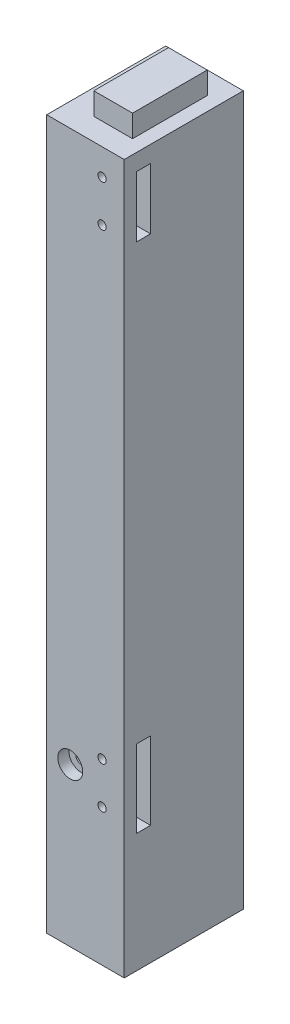
from build123d import *

# Parameters (mm, degrees)
SKETCH1_W           = 88.9
SKETCH1_H           = 812.8
BOSS_EXTRUDE1_DEPTH = 136.525
SKETCH2_W           = 44.45
SKETCH2_H           = 85.725
BOSS_EXTRUDE2_DEPTH = 25.4
SKETCH4_W           = 15.875
SKETCH4_H           = 88.9
SKETCH4_H_2         = 69.85
CUT_EXTRUDE1_DEPTH  = 50.8
SKETCH5_W           = 25.4
SKETCH5_H           = 82.55
CUT_EXTRUDE2_DEPTH  = 50.8
SKETCH6_R           = 14.2875
CUT_EXTRUDE3_DEPTH  = 12.7
SKETCH7_R           = 6.35
CUT_EXTRUDE4_DEPTH  = 452.397466901
SKETCH6_4_R         = 4.7625
CUT_EXTRUDE5_DEPTH  = 44.45


with BuildPart() as part:
    # Sketch1 → Boss-Extrude1 (new body)
    with BuildSketch(Plane.XY):
        Rectangle(SKETCH1_W, SKETCH1_H)
    extrude(amount=BOSS_EXTRUDE1_DEPTH)

    # Sketch2 → Boss-Extrude2 (add)
    with BuildSketch(Plane(origin=(0, 406.4, 0), x_dir=(1, 0, 0), z_dir=(0, 1, 0))):
        with Locations((6.35, -68.2625)):
            Rectangle(SKETCH2_W, SKETCH2_H)
    extrude(amount=BOSS_EXTRUDE2_DEPTH)

    # Sketch4 → Cut-Extrude1 (cut)
    with BuildSketch(Plane(origin=(44.45, 0, 0), x_dir=(0, 0, -1), z_dir=(1, 0, 0))):
        with Locations((-114.3, -225.425)):
            Rectangle(SKETCH4_W, SKETCH4_H)
        with Locations((-114.3, 352.425)):
            Rectangle(SKETCH4_W, SKETCH4_H_2)
    extrude(amount=-CUT_EXTRUDE1_DEPTH, mode=Mode.SUBTRACT)

    # Sketch5 → Cut-Extrude2 (cut)
    with BuildSketch(Plane(origin=(0, 0, 0), x_dir=(-1, 0, 0), z_dir=(0, 0, -1))):
        with Locations((17.4625, -225.425)):
            Rectangle(SKETCH5_W, SKETCH5_H)
    extrude(amount=-CUT_EXTRUDE2_DEPTH, mode=Mode.SUBTRACT)

    # Sketch6 → Cut-Extrude3 (cut)
    with BuildSketch(Plane.XY.offset(136.525)):
        with Locations((-17.4625, -225.425)):
            Circle(SKETCH6_R)
    extrude(amount=-CUT_EXTRUDE3_DEPTH, mode=Mode.SUBTRACT)

    # Sketch7 → Cut-Extrude4 (cut, through all)
    with BuildSketch(Plane.XY.offset(123.825)):
        with Locations((-17.4625, -225.425)):
            Circle(SKETCH7_R)
    extrude(amount=-CUT_EXTRUDE4_DEPTH, mode=Mode.SUBTRACT)

    # Sketch6<4> → Cut-Extrude5 (cut)
    with BuildSketch(Plane.XY.offset(136.525)):
        with Locations((19.05, 376.2375)):
            Circle(SKETCH6_4_R)
        with Locations((19.05, 328.6125)):
            Circle(SKETCH6_4_R)
        with Locations((19.05, -249.2375)):
            Circle(SKETCH6_4_R)
        with Locations((19.05, -201.6125)):
            Circle(SKETCH6_4_R)
    extrude(amount=-CUT_EXTRUDE5_DEPTH, mode=Mode.SUBTRACT)


solid = part.part
